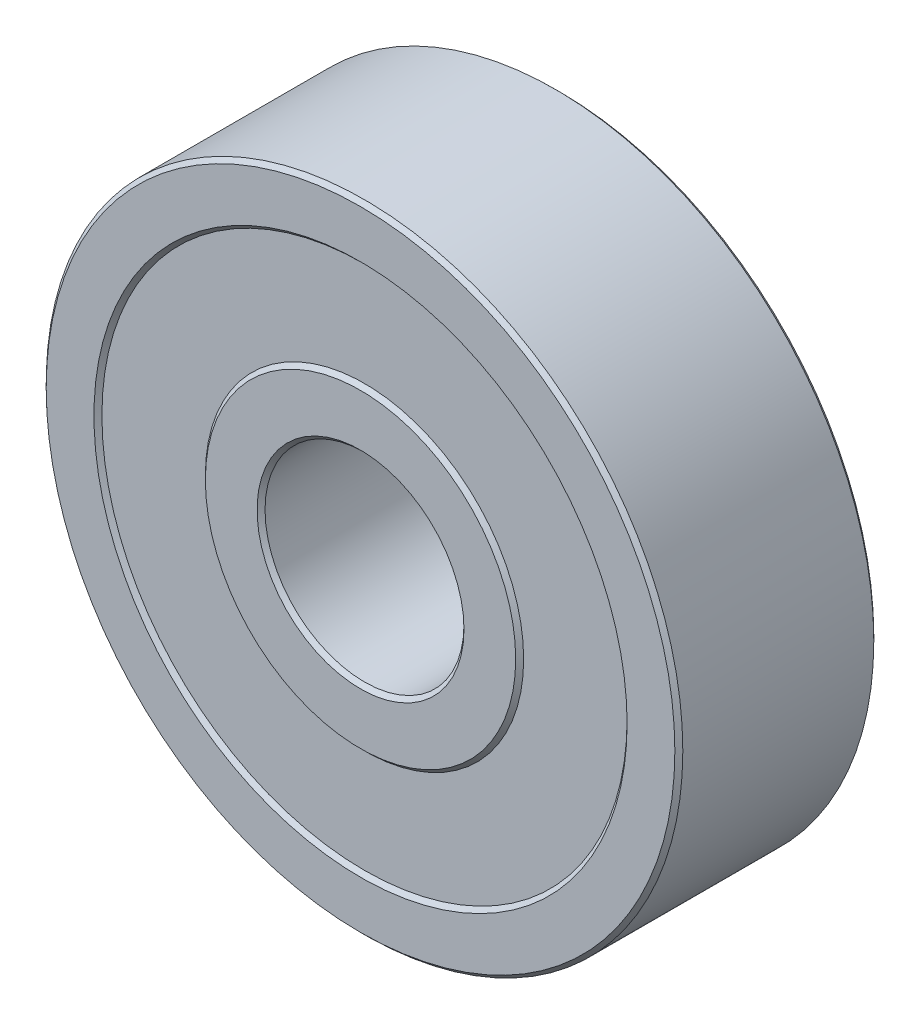
from build123d import *

# Parameters (mm, degrees)
SKIZZE1_R                       = 8
SKIZZE1_R_2                     = 2.5
AUFSATZ_LINEAR_AUSTRAGEN1_DEPTH = 2.5
SKETCH1_W                       = 2.6
SKETCH1_H                       = 0.1
CHAMFER1_SIZE                   = 0.1


with BuildPart() as part:
    # Skizze1 → Aufsatz-Linear austragen1 (new, symmetric)
    with BuildSketch(Plane.XY):
        Circle(SKIZZE1_R)
        Circle(SKIZZE1_R_2, mode=Mode.SUBTRACT)
    extrude(amount=AUFSATZ_LINEAR_AUSTRAGEN1_DEPTH, both=True)

    # Sketch1 → Cut-Revolve1 (revolve, cut)
    with BuildSketch(Plane(origin=(0, 0, 0), x_dir=(1, 0, 0), z_dir=(0, 1, 0)), mode=Mode.PRIVATE) as cut_revolve1_sk:
        with Locations((5.3, 2.45)):
            Rectangle(SKETCH1_W, SKETCH1_H)
        with Locations((5.3, -2.45)):
            Rectangle(SKETCH1_W, SKETCH1_H)
    revolve(cut_revolve1_sk.sketch.rotate(Axis((0, 0, -2.5), (0, 0, 1)), 180), axis=Axis((0, 0, -2.5), (0, 0, 1)), mode=Mode.SUBTRACT)

    # Chamfer1
    chamfer1_edges = [part.edges().sort_by_distance(p)[0] for p in [
        (6.6, 0, -2.5),
        (4, 0, -2.5),
        (4, 0, 2.5),
        (6.6, 0, 2.5),
        (-8, 0, -2.5),
        (-8, 0, 2.5),
        (-2.5, 0, -2.5),
        (-2.5, 0, 2.5),
    ]]
    chamfer(chamfer1_edges, length=CHAMFER1_SIZE - 0.0001)  # a hair under: the kernel refuses the full size


solid = part.part
